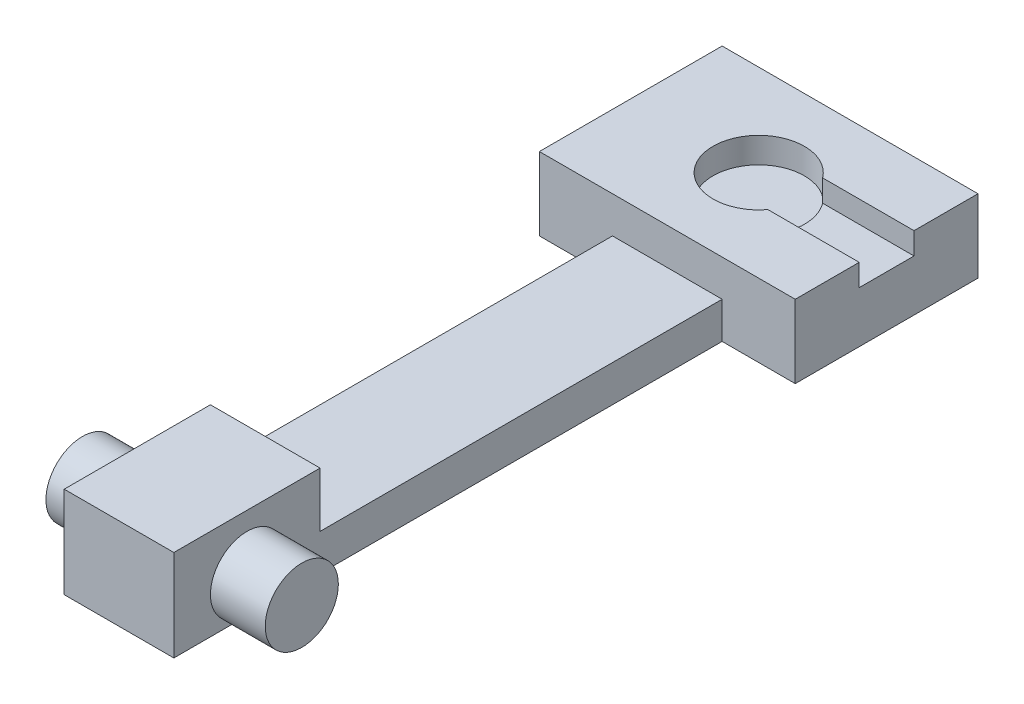
from build123d import *

# Parameters (mm, degrees)
BOSS_EXTRUDE1_DEPTH      = 20
SKETCH2_R                = 12.5
CUT_EXTRUDE1_DEPTH       = 7
SKETCH3_W                = 38
SKETCH3_H                = 15
CUT_EXTRUDE2_DEPTH       = 6
SKETCH7_W                = 30
SKETCH7_H                = 40
BOSS_EXTRUDE2_DEPTH      = 5
BOSS_EXTRUDE3_DEPTH      = 15
BOSS_EXTRUDE3_DEPTH_BACK = 45
SKETCH8_R                = 10
SKETCH9_W                = 30
SKETCH9_H                = 110
CUT_EXTRUDE3_DEPTH       = 10


with BuildPart() as part:
    # Sketch1 → Boss-Extrude1 (new body)
    with BuildSketch(Plane(origin=(0, 0, 0), x_dir=(1, 0, 0), z_dir=(0, 1, 0))):
        Polygon((0, 0), (30, 0), (30, 150), (50, 150), (50, 200), (-20, 200), (-20, 150), (0, 150), align=None)
    extrude(amount=BOSS_EXTRUDE1_DEPTH)

    # Sketch2 → Cut-Extrude1 (cut)
    with BuildSketch(Plane(origin=(0, 20, 0), x_dir=(1, 0, 0), z_dir=(0, 1, 0))):
        with Locations((15, 175)):
            Circle(SKETCH2_R)
    extrude(amount=-CUT_EXTRUDE1_DEPTH, mode=Mode.SUBTRACT)

    # Sketch3 → Cut-Extrude2 (cut)
    with BuildSketch(Plane(origin=(0, 20, 0), x_dir=(1, 0, 0), z_dir=(0, 1, 0))):
        with Locations((31, 175)):
            Rectangle(SKETCH3_W, SKETCH3_H)
    extrude(amount=-CUT_EXTRUDE2_DEPTH, mode=Mode.SUBTRACT)

    # Sketch7 → Boss-Extrude2 (add)
    with BuildSketch(Plane(origin=(0, 20, 0), x_dir=(1, 0, 0), z_dir=(0, 1, 0))):
        with Locations((15, 20)):
            Rectangle(SKETCH7_W, SKETCH7_H)
    extrude(amount=BOSS_EXTRUDE2_DEPTH)

    # Sketch8 → Boss-Extrude3 (add, two sides: drawn at the far end of the back side and taken through both)
    with BuildSketch(Plane(origin=(30, 0, 0), x_dir=(0, 0, -1), z_dir=(1, 0, 0)).offset(-BOSS_EXTRUDE3_DEPTH_BACK)):
        with Locations((20, 10)):
            Circle(SKETCH8_R)
    extrude(amount=BOSS_EXTRUDE3_DEPTH + BOSS_EXTRUDE3_DEPTH_BACK)

    # Sketch9 → Cut-Extrude3 (cut)
    with BuildSketch(Plane(origin=(0, 20, 0), x_dir=(1, 0, 0), z_dir=(0, 1, 0))):
        with Locations((15, 95)):
            Rectangle(SKETCH9_W, SKETCH9_H)
    extrude(amount=-CUT_EXTRUDE3_DEPTH, mode=Mode.SUBTRACT)


solid = part.part
